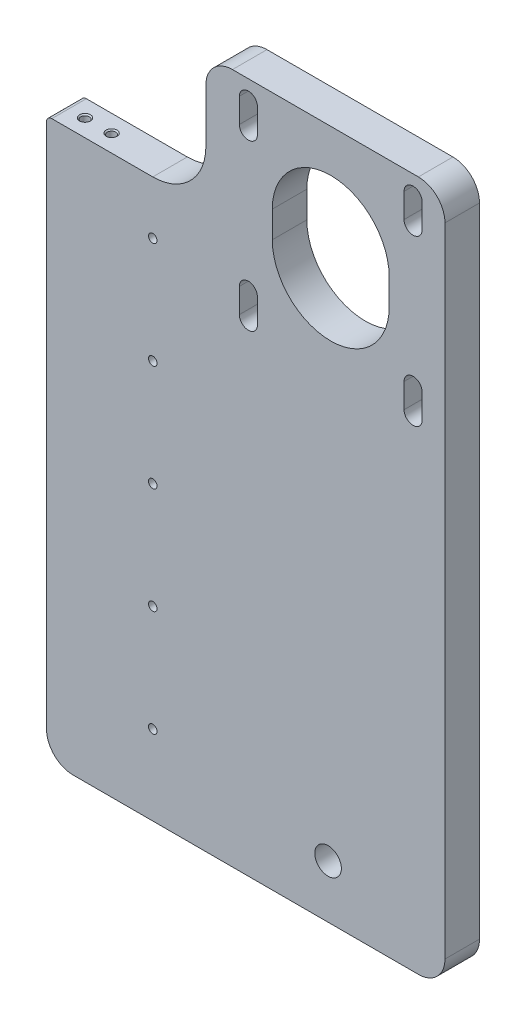
from build123d import *
from OCP.BRepFilletAPI import BRepFilletAPI_MakeFillet

# Parameters (mm, degrees)
SKETCH1_W                         = 37.5
SKETCH1_H                         = 130
MOUNTING_PLATE_DEPTH              = 6.5
M3_CLEARANCE_SLOT1_DEPTH          = 6.5
LPATTERN4_COUNT                   = 2
LPATTERN4_PITCH                   = 31
LPATTERN4_COUNT_DIR2              = 2
LPATTERN4_PITCH_DIR2              = 31
CUT_EXTRUDE3_DEPTH                = 136.456635127
LIMIT_SWITCH_PLACEMENT_DEPTH      = 136.456635127
LIMIT_SWITCH_PLACEMENT_DEPTH_BACK = 136.456635127
M2X0_4_TAPPED_HOLE3_D             = 1.6
LPATTERN5_COUNT                   = 5
LPATTERN5_PITCH                   = 20
FILLET1_R1                        = 5
FILLET1_R2                        = 1
M3X0_5_TAPPED_HOLE1_D             = 2.5
M3X0_5_TAPPED_HOLE1_DEPTH         = 7.5
M3X0_5_TAPPED_HOLE1_TIP           = 0.751075774
LPATTERN3_COUNT                   = 2
LPATTERN3_PITCH                   = 5
LPATTERN6_COUNT                   = 2
LPATTERN6_PITCH                   = 15
LPATTERN6_COUNT_DIR2              = 2
LPATTERN6_PITCH_DIR2              = 20
SKETCH30_R                        = 2.5
CUT_EXTRUDE4_DEPTH                = 136.456635127


# Read off the part's stored shape, not the designer's step: M3 Clearance Slot1
with BuildPart() as part:
    # Sketch1 → Mounting Plate (new body)
    with BuildSketch(Plane.XY):
        with Locations((-18.75, 65)):
            Rectangle(SKETCH1_W, SKETCH1_H)
        with Locations((18.75, 65)):
            Rectangle(SKETCH1_W, SKETCH1_H)
    extrude(amount=MOUNTING_PLATE_DEPTH)

    # M3 Clearance Slot1 outline → M3 Clearance Slot1 (cut)
    with BuildSketch(Plane.XY):
        with BuildLine():
            Line((2.2, 121.7), (2.2, 126.3))
            ThreePointArc((2.2, 126.3), (0.5, 128), (-1.2, 126.3))
            Line((-1.2, 126.3), (-1.2, 121.7))
            ThreePointArc((-1.2, 121.7), (0.5, 120), (2.2, 121.7))
        make_face()
    m3_clearance_slot1 = extrude(amount=M3_CLEARANCE_SLOT1_DEPTH, mode=Mode.SUBTRACT)

    # LPattern4: M3 Clearance Slot1 2 × 2
    with Locations(*[(i * LPATTERN4_PITCH, -j * LPATTERN4_PITCH_DIR2, 0) for i in range(LPATTERN4_COUNT) for j in range(LPATTERN4_COUNT_DIR2) if (i, j) != (0, 0)]):
        add(m3_clearance_slot1, mode=Mode.SUBTRACT)

    # Sketch23 → Cut-Extrude3 (cut, through all)
    with BuildSketch(Plane.XY.offset(6.5)):
        with BuildLine():
            Line((27, 111), (27, 106))
            ThreePointArc((27, 106), (16, 95), (5, 106))
            Line((5, 106), (5, 111))
            ThreePointArc((5, 111), (16, 122), (27, 111))
        make_face()
    extrude(amount=-CUT_EXTRUDE3_DEPTH, mode=Mode.SUBTRACT)

    # Sketch2 → Limit Switch Placement (cut, two sides: drawn at the far end of the back side and taken through both)
    with BuildSketch(Plane.XY.offset(6.5).offset(-LIMIT_SWITCH_PLACEMENT_DEPTH_BACK)):
        with BuildLine():
            Line((-7.5, 415.136329844), (-7.5, 130))
            Line((-7.5, 130), (-7.5, 115))
            ThreePointArc((-7.5, 115), (-10.428932188, 107.928932188), (-17.5, 105))
            Line((-17.5, 105), (-37.5, 105))
            Line((-37.5, 105), (-322.636329844, 105))
            Line((-322.636329844, 105), (-722.642663203, 511.455212366))
            Line((-722.642663203, 511.455212366), (-407.50633336, 821.59154221))
            Line((-407.50633336, 821.59154221), (-7.5, 415.136329844))
        make_face()
    extrude(amount=LIMIT_SWITCH_PLACEMENT_DEPTH + LIMIT_SWITCH_PLACEMENT_DEPTH_BACK, mode=Mode.SUBTRACT)

    # M2x0.4 Tapped Hole3 (through all)
    with Locations(Plane.XY.offset(6.5)):
        with Locations((-17.5, 95)):
            m2x0_4_tapped_hole3 = Hole(M2X0_4_TAPPED_HOLE3_D / 2)

    # LPattern5: M2x0.4 Tapped Hole3 ×5
    with Locations(*[(0, -i * LPATTERN5_PITCH, 0) for i in range(1, LPATTERN5_COUNT)]):
        add(m2x0_4_tapped_hole3, mode=Mode.SUBTRACT)

    # Fillet1: one fillet with a radius per group of edges: ONE call of the kernel's fillet builder (fillet() takes one radius for all edges)
    fillet1_edges_1 = [part.edges().sort_by_distance(p)[0] for p in [
        (37.5, 130, 3.25),
        (37.5, 0, 3.25),
        (-37.5, 0, 3.25),
        (-7.5, 130, 3.25),
    ]]
    fillet1_edges_2 = [part.edges().sort_by_distance(p)[0] for p in [
        (-37.5, 105, 3.25),
    ]]
    fillet1 = BRepFilletAPI_MakeFillet(part.part.solid().wrapped)
    for e in fillet1_edges_1:
        fillet1.Add(FILLET1_R1, e.wrapped)
    for e in fillet1_edges_2:
        fillet1.Add(FILLET1_R2, e.wrapped)
    add(Compound.cast(fillet1.Shape()), mode=Mode.REPLACE)

    # M3x0.5 Tapped Hole1
    with Locations(Plane(origin=(0, 0, 0), x_dir=(-1, 0, 0), z_dir=(0, -1, 0))):
        with Locations((-18.5, -3.25), (-12.5, -3.25)):
            Hole(M3X0_5_TAPPED_HOLE1_D / 2, depth=M3X0_5_TAPPED_HOLE1_DEPTH)
            with Locations((0, 0, -(M3X0_5_TAPPED_HOLE1_DEPTH + M3X0_5_TAPPED_HOLE1_TIP / 2))):  # 118° drill point
                Cone(0, M3X0_5_TAPPED_HOLE1_D / 2, M3X0_5_TAPPED_HOLE1_TIP, mode=Mode.SUBTRACT)

    # Sketch15 → M2x0.4 Tapped Hole2 (revolve, cut)
    with BuildSketch(Plane(origin=(-33.5, 105, 3.25), x_dir=(0, 0, 1), z_dir=(1, 0, 0))):
        Polygon((0, 0), (0, 5.680688495), (0.8, 5.2), (0.8, 0.225), (1.025, 0), align=None)
    m2x0_4_tapped_hole2 = revolve(axis=Axis((-33.5, 111.35, 3.25), (0, -1, 0)), mode=Mode.SUBTRACT)

    # LPattern3: M2x0.4 Tapped Hole2 ×2
    with Locations(*[(i * LPATTERN3_PITCH, 0, 0) for i in range(1, LPATTERN3_COUNT)]):
        add(m2x0_4_tapped_hole2, mode=Mode.SUBTRACT)

    # Sketch29 → M3x0.5 Tapped Hole4 (revolve, cut)
    with BuildSketch(Plane(origin=(23.5, 40, 0), x_dir=(0, 1, 0), z_dir=(1, 0, 0))):
        Polygon((0, 0), (0, 6.251075774), (1.25, 5.5), (1.25, 0), align=None)
    m3x0_5_tapped_hole4 = revolve(axis=Axis((23.5, 40, -6.35), (0, 0, 1)), mode=Mode.SUBTRACT)

    # LPattern6: M3x0.5 Tapped Hole4 2 × 2
    with Locations(*[(-i * LPATTERN6_PITCH, -j * LPATTERN6_PITCH_DIR2, 0) for i in range(LPATTERN6_COUNT) for j in range(LPATTERN6_COUNT_DIR2) if (i, j) != (0, 0)]):
        add(m3x0_5_tapped_hole4, mode=Mode.SUBTRACT)

    # Sketch30 → Cut-Extrude4 (cut, through all)
    with BuildSketch(Plane.XY.offset(6.5)):
        with Locations((15.5, 10)):
            Circle(SKETCH30_R)
    extrude(amount=-CUT_EXTRUDE4_DEPTH, mode=Mode.SUBTRACT)


solid = part.part
